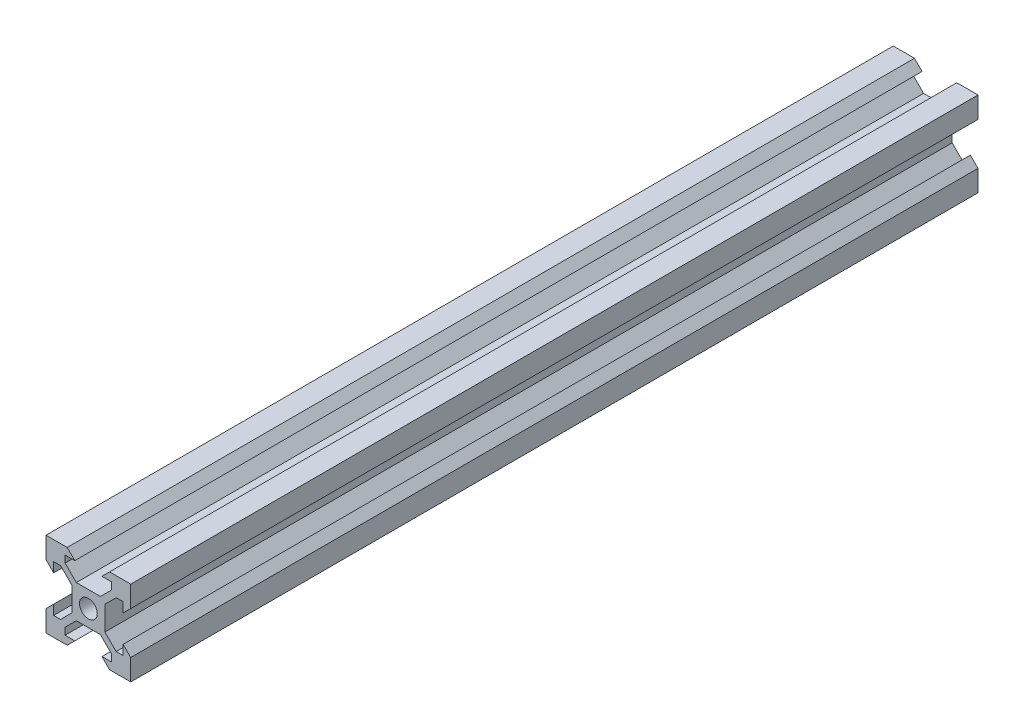
from build123d import *

# Parameters (mm, degrees)
SKETCH1_R           = 2.1
BOSS_EXTRUDE1_DEPTH = 100


with BuildPart() as part:
    # Sketch1 → Boss-Extrude1 (new, symmetric)
    with BuildSketch(Plane.XY):
        Polygon((-10, 10), (-5, 10), (-3.2, 8.2), (-5.499339828, 8.2), (-5.499339828, 6.56), (-2.84, 3.900660172), (2.84, 3.900660172), (5.499339828, 6.56), (5.499339828, 8.2), (3.2, 8.2), (5, 10), (10, 10), (10, 5), (8.2, 3.2), (8.2, 5.499339828), (6.56, 5.499339828), (3.900660172, 2.84), (3.900660172, -2.84), (6.56, -5.499339828), (8.2, -5.499339828), (8.2, -3.2), (10, -5), (10, -10), (5, -10), (3.2, -8.2), (5.499339828, -8.2), (5.499339828, -6.56), (2.84, -3.900660172), (-2.84, -3.900660172), (-5.499339828, -6.56), (-5.499339828, -8.2), (-3.2, -8.2), (-5, -10), (-10, -10), (-10, -5), (-8.2, -3.2), (-8.2, -5.499339828), (-6.56, -5.499339828), (-3.900660172, -2.84), (-3.900660172, 2.84), (-6.56, 5.499339828), (-8.2, 5.499339828), (-8.2, 3.2), (-10, 5), align=None)
        Circle(SKETCH1_R, mode=Mode.SUBTRACT)
    extrude(amount=BOSS_EXTRUDE1_DEPTH, both=True)


solid = part.part
